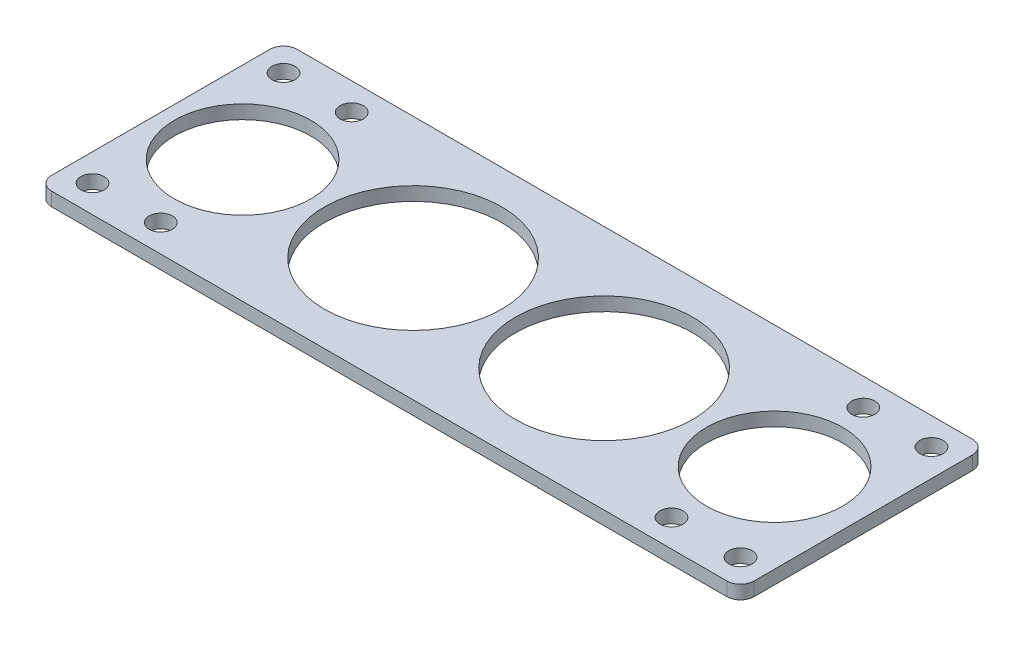
from build123d import *

# Parameters (mm, degrees)
SKETCH2_W           = 103
SKETCH2_H           = 36
SKETCH2_R           = 1.7
SKETCH2_R_2         = 13
SKETCH2_R_3         = 10
BOSS_EXTRUDE1_DEPTH = 2
FILLET1_R           = 2


with BuildPart() as part:
    # Sketch2 → Boss-Extrude1 (new body)
    with BuildSketch(Plane(origin=(0, 0, 0), x_dir=(1, 0, 0), z_dir=(0, 1, 0))):
        with Locations((1.308496413, 2.428579377)):
            Rectangle(SKETCH2_W, SKETCH2_H)
        with Locations((-46.191503587, 16.428579377)):
            Circle(SKETCH2_R, mode=Mode.SUBTRACT)
        with Locations((-46.191503587, -11.571420623)):
            Circle(SKETCH2_R, mode=Mode.SUBTRACT)
        with Locations((48.808496413, 16.428579377)):
            Circle(SKETCH2_R, mode=Mode.SUBTRACT)
        with Locations((48.808496413, -11.571420623)):
            Circle(SKETCH2_R, mode=Mode.SUBTRACT)
        with Locations((14.808496413, 2.428579377)):
            Circle(SKETCH2_R_2, mode=Mode.SUBTRACT)
        with Locations((-36.191503587, 16.428579377)):
            Circle(SKETCH2_R, mode=Mode.SUBTRACT)
        with Locations((-36.191503587, -11.571420623)):
            Circle(SKETCH2_R, mode=Mode.SUBTRACT)
        with Locations((38.808496413, 16.428579377)):
            Circle(SKETCH2_R, mode=Mode.SUBTRACT)
        with Locations((38.690387475, -11.571420623)):
            Circle(SKETCH2_R, mode=Mode.SUBTRACT)
        with Locations((-13.191503587, 2.428579377)):
            Circle(SKETCH2_R_2, mode=Mode.SUBTRACT)
        with Locations((-38.191503587, 2.428579377)):
            Circle(SKETCH2_R_3, mode=Mode.SUBTRACT)
        with Locations((39.808496413, 2.428579377)):
            Circle(SKETCH2_R_3, mode=Mode.SUBTRACT)
    extrude(amount=BOSS_EXTRUDE1_DEPTH)

    # Fillet1
    fillet1_edges = [part.edges().sort_by_distance(p)[0] for p in [
        (52.808496413, 1, -20.428579377),
        (52.808496413, 1, 15.571420623),
        (-50.191503587, 1, -20.428579377),
        (-50.191503587, 1, 15.571420623),
    ]]
    fillet(fillet1_edges, radius=FILLET1_R)


solid = part.part
